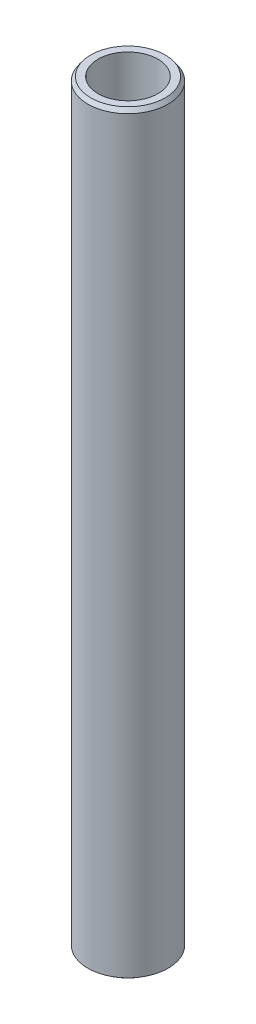
from build123d import *
from OCP.BRepFilletAPI import BRepFilletAPI_MakeChamfer

# Parameters (mm, degrees)
SKETCH1_R           = 25
BOSS_EXTRUDE1_DEPTH = 470.416780713
SKETCH2_R           = 18.64260914
CUT_EXTRUDE1_DEPTH  = 472.743518849
CHAMFER1_SIZE       = 2.479125491
CHAMFER1_SIZE2      = 1.821936789


with BuildPart() as part:
    # Sketch1 → Boss-Extrude1 (new body)
    with BuildSketch(Plane(origin=(0, 0, 0), x_dir=(1, 0, 0), z_dir=(0, 1, 0))):
        Circle(SKETCH1_R)
    extrude(amount=BOSS_EXTRUDE1_DEPTH)

    # Sketch2 → Cut-Extrude1 (cut, through all)
    with BuildSketch(Plane(origin=(0, 0, 0), x_dir=(1, 0, 0), z_dir=(0, 1, 0))):
        Circle(SKETCH2_R)
    extrude(amount=CUT_EXTRUDE1_DEPTH, mode=Mode.SUBTRACT)

    # Chamfer1: one chamfer whose edges measure the first distance from different faces: ONE call of the kernel's chamfer builder (chamfer() names one face for all edges)
    chamfer1_edges_1 = [part.edges().sort_by_distance(p)[0] for p in [
        (-25, 470.416780713, 0),
    ]]
    chamfer1_side_1 = [part.faces().sort_by_distance(p)[0] for p in [
        (-25, 235.208390356, 0),
    ]]
    chamfer1_edges_2 = [part.edges().sort_by_distance(p)[0] for p in [
        (-25, 0, 0),
    ]]
    chamfer1_side_2 = [part.faces().sort_by_distance(p)[0] for p in [
        (-24.292893219, 0, 0),
    ]]
    chamfer1 = BRepFilletAPI_MakeChamfer(part.part.solid().wrapped)
    for e in chamfer1_edges_1:
        chamfer1.Add(CHAMFER1_SIZE, CHAMFER1_SIZE2, e.wrapped, chamfer1_side_1[0].wrapped)  # the first distance lies on this face
    for e in chamfer1_edges_2:
        chamfer1.Add(CHAMFER1_SIZE, CHAMFER1_SIZE2, e.wrapped, chamfer1_side_2[0].wrapped)  # the first distance lies on this face
    add(Compound.cast(chamfer1.Shape()), mode=Mode.REPLACE)


solid = part.part
